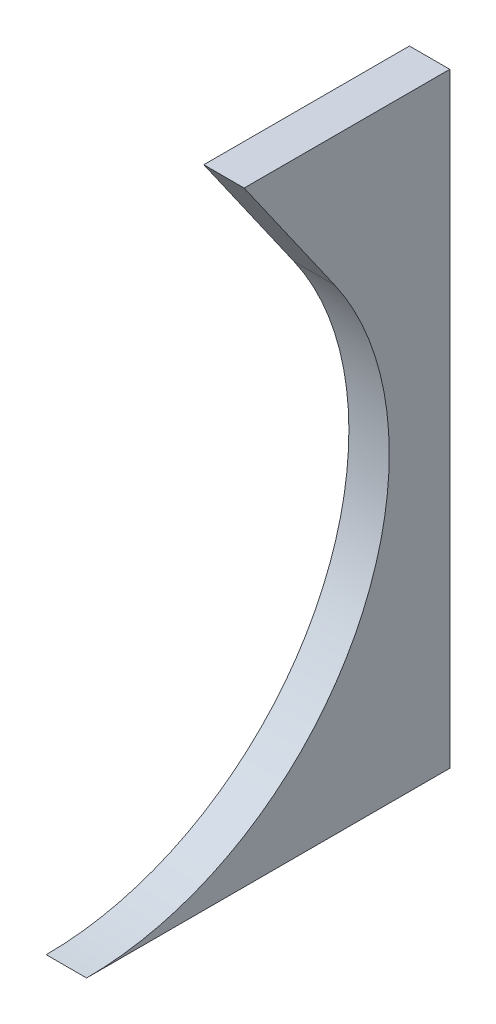
from build123d import *

# Parameters (mm, degrees)
SKETCH1_W           = 228.6
SKETCH1_H           = 381
BOSS_EXTRUDE1_DEPTH = 25.4
SKETCH2_R           = 190.5
CUT_EXTRUDE1_DEPTH  = 261.427427511
CUT_EXTRUDE2_DEPTH  = 261.427427511


with BuildPart() as part:
    # Sketch1 → Boss-Extrude1 (new body)
    with BuildSketch(Plane(origin=(0, 0, 0), x_dir=(0, 0, -1), z_dir=(1, 0, 0))):
        with Locations((19.05, 31.75)):
            Rectangle(SKETCH1_W, SKETCH1_H)
    extrude(amount=BOSS_EXTRUDE1_DEPTH)

    # Sketch2 → Cut-Extrude1 (cut, through all)
    with BuildSketch(Plane(origin=(25.4, 0, 0), x_dir=(0, 0, -1), z_dir=(1, 0, 0))):
        with Locations((-95.25, 31.75)):
            Circle(SKETCH2_R)
    extrude(amount=-CUT_EXTRUDE1_DEPTH, mode=Mode.SUBTRACT)

    # Sketch3 → Cut-Extrude2 (cut, through all)
    with BuildSketch(Plane(origin=(25.4, 0, 0), x_dir=(0, 0, -1), z_dir=(1, 0, 0))):
        Polygon((60.798464437, 141.016311125), (-14.580708336, 248.66892647), (-203.446235094, 248.66892647), (-203.446235094, 141.016311125), align=None)
    extrude(amount=-CUT_EXTRUDE2_DEPTH, mode=Mode.SUBTRACT)


solid = part.part
